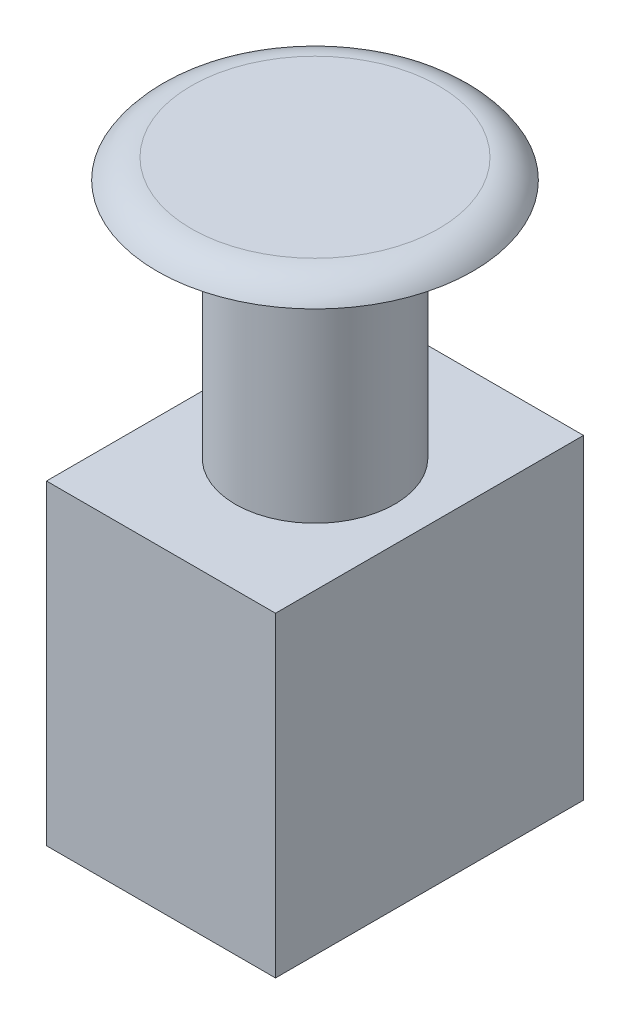
from build123d import *

# Parameters (mm, degrees)
SKETCH1_W           = 29
SKETCH1_H           = 39
BOSS_EXTRUDE1_DEPTH = 40
SKETCH2_R           = 10.1
BOSS_EXTRUDE2_DEPTH = 33
SKETCH3_R           = 20
BOSS_EXTRUDE3_DEPTH = 2.5
FILLET1_R           = 5


with BuildPart() as part:
    # Sketch1 → Boss-Extrude1 (new body)
    with BuildSketch(Plane(origin=(0, 0, 0), x_dir=(1, 0, 0), z_dir=(0, 1, 0))):
        Rectangle(SKETCH1_W, SKETCH1_H)
    extrude(amount=BOSS_EXTRUDE1_DEPTH)

    # Sketch2 → Boss-Extrude2 (add)
    with BuildSketch(Plane(origin=(0, 40, 0), x_dir=(1, 0, 0), z_dir=(0, 1, 0))):
        with Locations(Location((0, 0, 0), (0, 0, 270))):
            Circle(SKETCH2_R)
    extrude(amount=BOSS_EXTRUDE2_DEPTH)

    # Sketch3 → Boss-Extrude3 (add)
    with BuildSketch(Plane(origin=(0, 73, 0), x_dir=(1, 0, 0), z_dir=(0, 1, 0))):
        with Locations(Location((0, 0, 0), (0, 0, 270))):
            Circle(SKETCH3_R)
    extrude(amount=-BOSS_EXTRUDE3_DEPTH)

    # Fillet1
    # the kernel refuses this fillet: 5 mm, written as the material it takes off along each edge
    with BuildSketch(Plane(origin=(0, 73, 0), x_dir=(0, 0, 1), z_dir=(-1, 0, 0))) as fillet1_piece_1:
        with BuildLine():
            CenterArc((15.669872981, -5), FILLET1_R, 30, 60)
            Line((15.669872981, 0), (15.669872981, 0.1))
            Line((15.669872981, 0.1), (20, 0.1))
            Line((20, 0.1), (20.1, 0))
            ThreePointArc((20.1, 0), (20.1, -1.25), (20.08660254, -2.45))
            Line((20.08660254, -2.45), (20, -2.5))
        make_face()
    revolve(axis=Axis((0, 73, 0), (0, 1, 0)), mode=Mode.SUBTRACT)


solid = part.part
